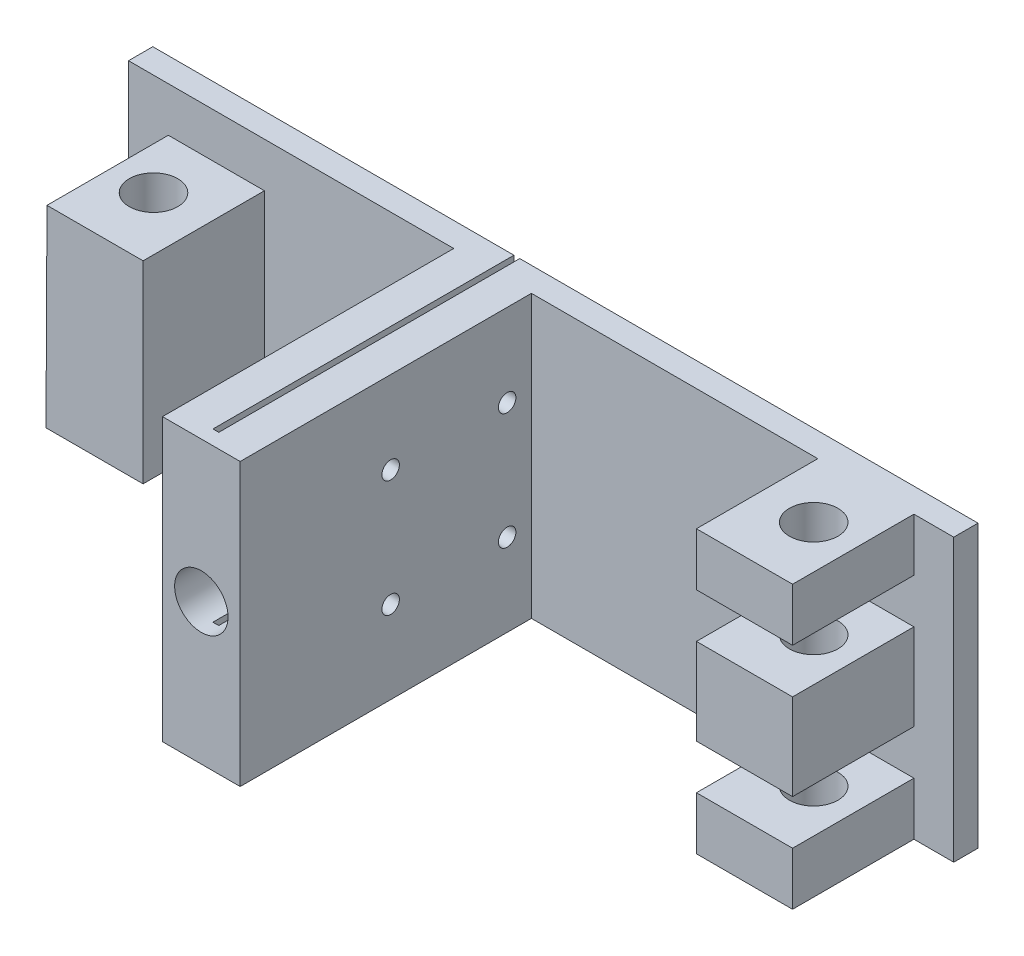
from build123d import *

# Parameters (mm, degrees)
SKETCH1_W           = 170
SKETCH1_H           = 58
BOSS_EXTRUDE1_DEPTH = 5
SKETCH2_W           = 28
SKETCH2_H           = 58
BOSS_EXTRUDE2_DEPTH = 25
CUT_EXTRUDE4_DEPTH  = 25
HOLE1_START         = -29
HOLE1_OUTLINE_R     = 5
HOLE1_DEPTH         = 58
SKETCH6_W           = 16
SKETCH6_H           = 58
BOSS_EXTRUDE3_DEPTH = 60
SKETCH7_W           = 1.2
SKETCH7_H           = 58
CUT_EXTRUDE5_DEPTH  = 62
SKETCH8_R           = 5.5
CUT_EXTRUDE6_DEPTH  = 100
SKETCH9_R           = 1.8
CUT_EXTRUDE7_DEPTH  = 20
HOLE3_START         = -20
HOLE3_OUTLINE_R     = 5
HOLE3_DEPTH         = 39.8


# Read off the part's stored shape, not the designer's step: Hole1, Hole3
with BuildPart() as part:
    # Sketch1 → Boss-Extrude1 (new body)
    with BuildSketch(Plane.XY):
        Rectangle(SKETCH1_W, SKETCH1_H)
    extrude(amount=BOSS_EXTRUDE1_DEPTH)

    # Sketch2 → Boss-Extrude2 (add)
    with BuildSketch(Plane(origin=(0, 0, 5), x_dir=(-1, 0, 0), z_dir=(0, 0, -1))):
        with Locations((71, 0)):
            Rectangle(SKETCH2_W, SKETCH2_H)
        with Locations((-71, 0)):
            Rectangle(SKETCH2_W, SKETCH2_H)
    extrude(amount=-BOSS_EXTRUDE2_DEPTH)

    # Sketch3 → Cut-Extrude4 (cut)
    with BuildSketch(Plane.XY.offset(30)):
        Polygon((-57, -29), (-57, -20), (-77, -20), (-76.8, 19.8), (-57, 19.8), (-57, 29), (-85, 29), (-85, -29), align=None)
        Polygon((56, 8.9), (56, 18.1), (76.8, 18.1), (76.8, 29), (85, 29), (85, -29), (76.8, -29), (76.8, -18.1), (56, -18.1), (56, -8.9), (76.8, -8.9), (76.8, 8.9), align=None)
    extrude(amount=-CUT_EXTRUDE4_DEPTH, mode=Mode.SUBTRACT)

    # Hole1 outline → Hole1 (cut)
    with BuildSketch(Plane(origin=(0, 0, 0), x_dir=(1, 0, 0), z_dir=(0, 1, 0)).offset(HOLE1_START)):
        with Locations((67.918134457, -16.770132162)):
            Circle(HOLE1_OUTLINE_R)
    extrude(amount=HOLE1_DEPTH, mode=Mode.SUBTRACT)

    # Sketch6 → Boss-Extrude3 (add)
    with BuildSketch(Plane.XY.offset(5)):
        with Locations((-10, 0)):
            Rectangle(SKETCH6_W, SKETCH6_H)
    extrude(amount=BOSS_EXTRUDE3_DEPTH)

    # Sketch7 → Cut-Extrude5 (cut)
    with BuildSketch(Plane(origin=(0, 0, 0), x_dir=(-1, 0, 0), z_dir=(0, 0, -1))):
        with Locations((10, 0)):
            Rectangle(SKETCH7_W, SKETCH7_H)
    extrude(amount=-CUT_EXTRUDE5_DEPTH, mode=Mode.SUBTRACT)

    # Sketch8 → Cut-Extrude6 (cut)
    with BuildSketch(Plane(origin=(0, 0, 0), x_dir=(-1, 0, 0), z_dir=(0, 0, -1))):
        with Locations(Location((10, 0, 0), (0, 0, 83.737086874))):
            Circle(SKETCH8_R)
    extrude(amount=-CUT_EXTRUDE6_DEPTH, mode=Mode.SUBTRACT)

    # Sketch9 → Cut-Extrude7 (cut)
    with BuildSketch(Plane.ZY.offset(18)):
        with Locations((34, 12)):
            Circle(SKETCH9_R)
        with Locations((10, 12)):
            Circle(SKETCH9_R)
        with Locations((10, -12)):
            Circle(SKETCH9_R)
        with Locations((34, -12)):
            Circle(SKETCH9_R)
    extrude(amount=-CUT_EXTRUDE7_DEPTH, mode=Mode.SUBTRACT)

    # Hole3 outline → Hole3 (cut)
    with BuildSketch(Plane(origin=(0, 0, 0), x_dir=(1, 0, 0), z_dir=(0, 1, 0)).offset(HOLE3_START)):
        with Locations((-68.081865543, -16.770132162)):
            Circle(HOLE3_OUTLINE_R)
    extrude(amount=HOLE3_DEPTH, mode=Mode.SUBTRACT)


solid = part.part
